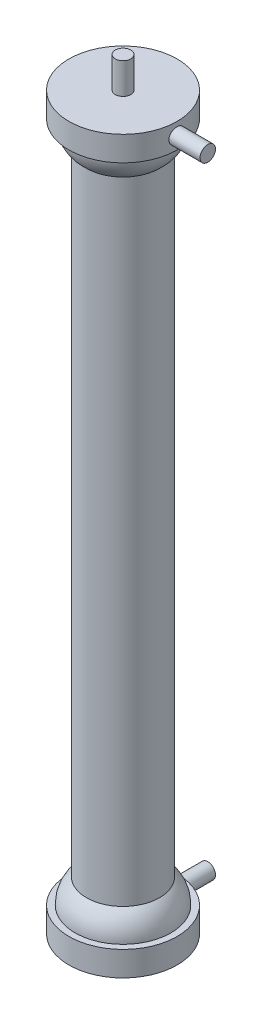
from build123d import *

# Parameters (mm, degrees)
SKETCH2_R           = 3.175
BOSS_EXTRUDE1_DEPTH = 34.798
SKETCH3_R           = 3.175
BOSS_EXTRUDE2_DEPTH = 34.798


with BuildPart() as part:
    # Sketch1 → Revolve1 (revolve)
    with BuildSketch(Plane.XY):
        with BuildLine():
            Line((15, 33.02), (15, 292.38))
            ThreePointArc((15, 292.38), (18.521588729, 296.916296192), (19.685, 302.54))
            Line((19.685, 302.54), (22.225, 302.54))
            Line((22.225, 302.54), (22.225, 312.7))
            Line((22.225, 312.7), (3.175, 312.7))
            Line((3.175, 312.7), (3.175, 325.4))
            Line((3.175, 325.4), (0, 325.4))
            Line((0, 325.4), (0, 0))
            Line((0, 0), (3.175, 0))
            Line((3.175, 0), (3.175, 12.7))
            Line((3.175, 12.7), (22.225, 12.7))
            Line((22.225, 12.7), (22.225, 22.86))
            Line((22.225, 22.86), (19.685, 22.86))
            ThreePointArc((19.685, 22.86), (18.521588729, 28.483703808), (15, 33.02))
        make_face()
    revolve(axis=Axis((0, -1025.4, 0), (0, 1, 0)))

    # Sketch2 → Boss-Extrude1 (add)
    with BuildSketch(Plane(origin=(0, 0, 0), x_dir=(0, 0, -1), z_dir=(1, 0, 0))):
        with Locations((0, 307.62)):
            Circle(SKETCH2_R)
    extrude(amount=BOSS_EXTRUDE1_DEPTH)

    # Sketch3 → Boss-Extrude2 (add)
    with BuildSketch(Plane.XY):
        with Locations((0, 17.78)):
            Circle(SKETCH3_R)
    extrude(amount=-BOSS_EXTRUDE2_DEPTH)


solid = part.part
